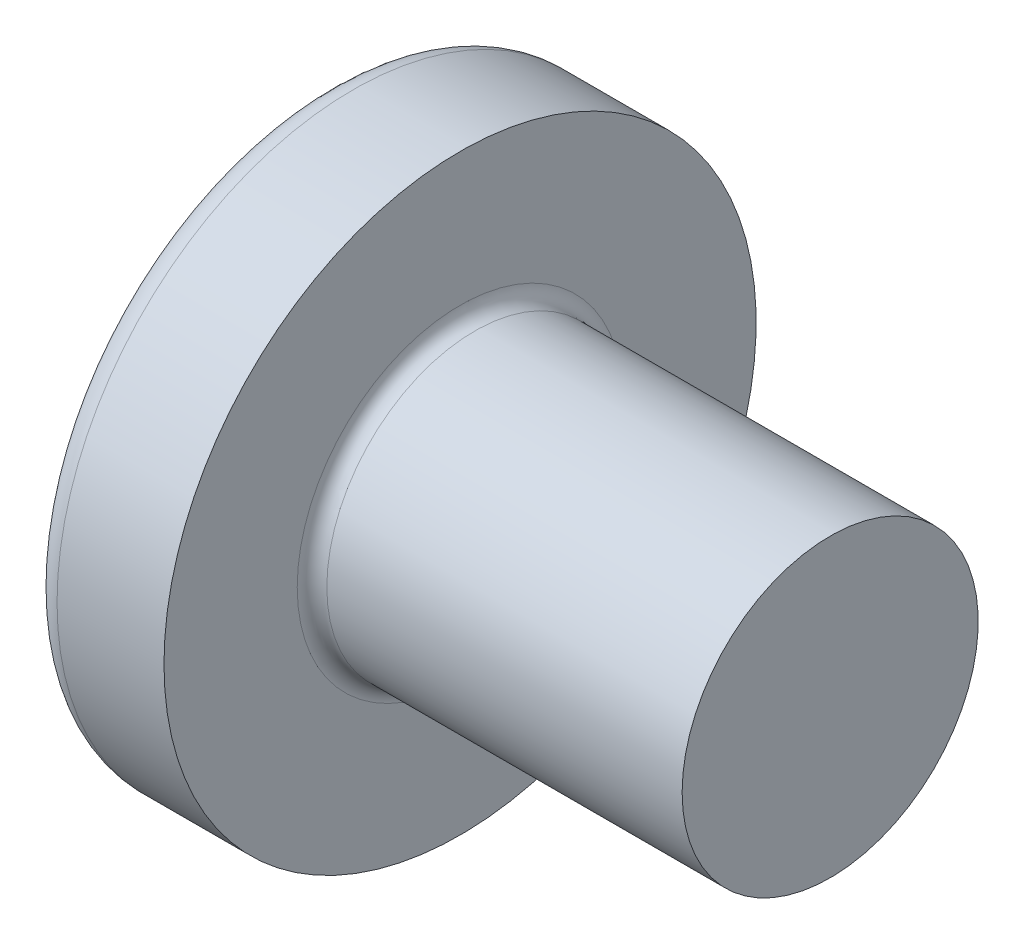
from build123d import *

# Parameters (mm, degrees)
RECPAT_COUNT = 2
RECPAT_ANGLE = 90


with BuildPart() as part:
    # Fillet1: read off the stored shape, not the designer's step
    # Fillet1 outline → Fillet1 (revolve)
    with BuildSketch(Plane.YX):
        with BuildLine():
            Line((4, 6.4), (4, 16))
            Line((4, 16), (0, 16))
            Line((0, 16), (0, 0))
            ThreePointArc((0, 0), (4.055866915, 0.648888974), (7.706840396, 2.530777913))
            ThreePointArc((7.706840396, 2.530777913), (7.922543805, 2.785746454), (8, 3.110611748))
            Line((8, 3.110611748), (8, 6))
            Line((8, 6), (4.4, 6))
            ThreePointArc((4.4, 6), (4.117157288, 6.117157288), (4, 6.4))
        make_face()
    revolve(axis=Axis((0, 0, 0), (1, 0, 0)))

    # Sketch3 → Recess section 0
    with BuildSketch(Plane(origin=(0, 0, 0), x_dir=(0, 0, -1), z_dir=(1, 0, 0))):
        with BuildLine():
            Line((1.08, -4.4), (-1.08, -4.4))
            Line((-1.08, -4.4), (-1.08, 4.4))
            Line((-1.08, 4.4), (1.08, 4.4))
            Line((1.08, 4.4), (1.08, -4.4))
        make_face()
    # Sketch4 → Recess section 1
    with BuildSketch(Plane(origin=(4.5, 0, 0), x_dir=(0, 0, -1), z_dir=(1, 0, 0))):
        with BuildLine():
            Line((1.08, -2.156383139), (-1.08, -2.156383139))
            Line((-1.08, -2.156383139), (-1.08, 2.156383139))
            Line((-1.08, 2.156383139), (1.08, 2.156383139))
            Line((1.08, 2.156383139), (1.08, -2.156383139))
        make_face()
    recess = loft(mode=Mode.SUBTRACT)

    # RecPat: Recess ×2 about axis
    recpat_axis = Axis((0, 0, 0), (1, 0, 0))
    for i in range(1, RECPAT_COUNT):
        add(recess.rotate(recpat_axis, i * RECPAT_ANGLE / (RECPAT_COUNT - 1)), mode=Mode.SUBTRACT)

    # RecCorSke → RecessCore (revolve, cut)
    with BuildSketch(Plane.XY, mode=Mode.PRIVATE) as recesscore_sk:
        Polygon((0, 0), (0, 2.245170654), (4.5, 1.9305), (5.127257474, 0), align=None)
    revolve(recesscore_sk.sketch.rotate(Axis((-3.175, 0, 0), (1, 0, 0)), 90), axis=Axis((-3.175, 0, 0), (1, 0, 0)), mode=Mode.SUBTRACT)


solid = part.part
